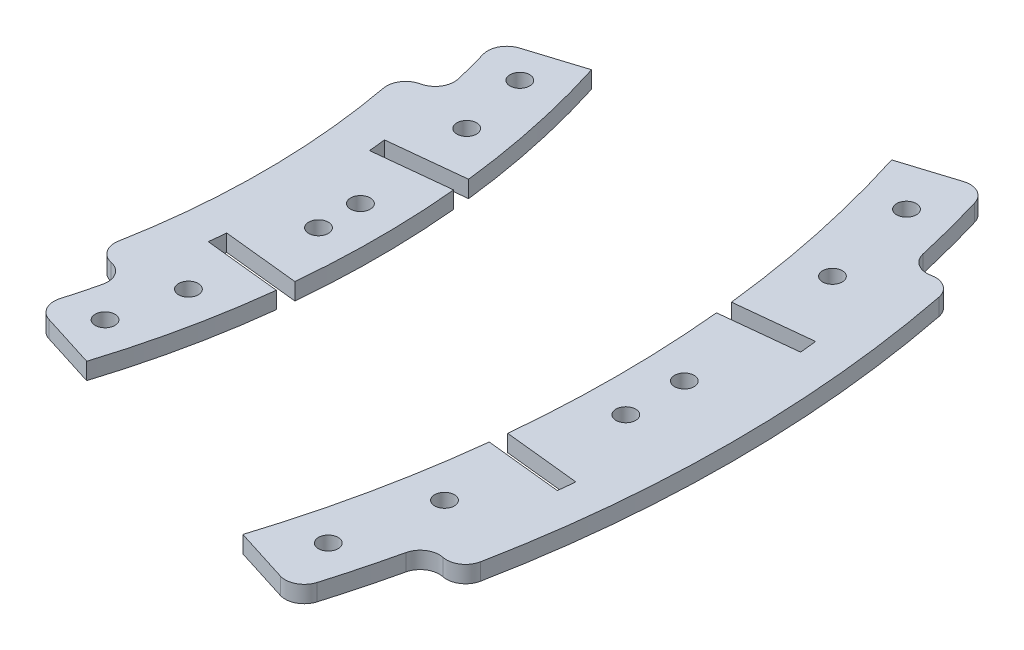
from build123d import *

# Parameters (mm, degrees)
BOSS_EXTRUDE1_DEPTH = 5.588
SKETCH9_R           = 3.2639
CUT_EXTRUDE4_DEPTH  = 5.588
CUT_EXTRUDE3_DEPTH  = 401.395458897
BOSS_EXTRUDE2_DEPTH = 5.588
FILLET1_R           = 6.35
SKETCH12_R          = 357.997386184
SKETCH12_R_2        = 278.622386184
CUT_EXTRUDE8_DEPTH  = 413.11957813
MIRROR1_OUTLINE_R   = 3.2639
MIRROR1_DEPTH       = 5.588


# Read off the part's stored shape, not the designer's step: Mirror1
with BuildPart() as part:
    # Sketch2 → Boss-Extrude1 (new body)
    with BuildSketch(Plane(origin=(0, 0, 0), x_dir=(1, 0, 0), z_dir=(0, 1, 0))):
        with BuildLine():
            Line((365.652586076, 115.28981754), (241.502482012, 76.14544009))
            ThreePointArc((241.502482012, 76.14544009), (250.275260093, 38.521046845), (253.222386184, 0))
            Line((253.222386184, 0), (383.397386184, 0))
            ThreePointArc((383.397386184, 0), (378.935219718, 58.323708643), (365.652586076, 115.28981754))
        make_face()
    extrude(amount=BOSS_EXTRUDE1_DEPTH)

    # Sketch9 → Cut-Extrude4 (cut)
    with BuildSketch(Plane(origin=(0, 0, 0), x_dir=(1, 0, 0), z_dir=(0, 1, 0))):
        with Locations(Location((256.861300603, 68.825778063, 0), (0, 0, 270))):
            Circle(SKETCH9_R)
        with Locations(Location((261.882427613, 46.176937762, 0), (0, 0, 270))):
            Circle(SKETCH9_R)
        with Locations(Location((265.831261224, 6.961036557, 0), (0, 0, 270))):
            Circle(SKETCH9_R)
        with Locations(Location((365.065659935, 64.370925577, 0), (0, 0, 270))):
            Circle(SKETCH9_R)
        with Locations(Location((358.066179053, 95.943543514, 0), (0, 0, 270))):
            Circle(SKETCH9_R)
        with Locations(Location((370.570357448, 9.703726316, 0), (0, 0, 270))):
            Circle(SKETCH9_R)
    extrude(amount=CUT_EXTRUDE4_DEPTH, mode=Mode.SUBTRACT)

    # Sketch8 → Cut-Extrude3 (cut, through all)
    with BuildSketch(Plane(origin=(0, 0, 0), x_dir=(1, 0, 0), z_dir=(0, 1, 0))):
        Polygon((251.928355604, 23.669347024), (283.504425782, 26.988125733), (282.92032073, 32.545514085), (251.344250552, 29.226735376), align=None)
        Polygon((350.211981914, 33.999372407), (381.788052092, 37.318151116), (381.203947039, 42.875539467), (349.627876862, 39.556760758), align=None)
    extrude(amount=CUT_EXTRUDE3_DEPTH, mode=Mode.SUBTRACT)

    # Sketch11 → Boss-Extrude2 (add)
    with BuildSketch(Plane(origin=(0, 0, 0), x_dir=(1, 0, 0), z_dir=(0, 1, 0))):
        with BuildLine():
            Line((247.688869498, 52.647894464), (235.266394968, 50.007415991))
            ThreePointArc((235.266394968, 50.007415991), (239.204779386, 25.141435409), (240.522386184, 0))
            Line((240.522386184, 0), (253.222386184, 0))
            ThreePointArc((253.222386184, 0), (251.835207457, 26.468946893), (247.688869498, 52.647894464))
        make_face()
        with BuildLine():
            Line((387.441707953, 82.35327729), (375.019233423, 79.712798817))
            ThreePointArc((375.019233423, 79.712798817), (381.297095187, 40.075939599), (383.397386184, 0))
            Line((383.397386184, 0), (396.097386184, 0))
            ThreePointArc((396.097386184, 0), (393.927523258, 41.403451082), (387.441707953, 82.35327729))
        make_face()
    extrude(amount=BOSS_EXTRUDE2_DEPTH)

    # Fillet1
    fillet1_edges = [part.edges().sort_by_distance(p)[0] for p in [
        (235.266394968, 2.794, -50.007415991),
        (387.441707953, 2.794, -82.35327729),
        (375.019233423, 2.794, -79.712798817),
        (247.688869498, 2.794, -52.647894464),
        (365.652586076, 2.794, -115.28981754),
        (241.502482012, 2.794, -76.14544009),
    ]]
    fillet(fillet1_edges, radius=FILLET1_R - 0.0001)  # a hair under: the kernel refuses the full size

    # Sketch12 → Cut-Extrude8 (cut, through all)
    with BuildSketch(Plane(origin=(0, 0, 0), x_dir=(1, 0, 0), z_dir=(0, 1, 0))):
        Circle(SKETCH12_R)
        Circle(SKETCH12_R_2, mode=Mode.SUBTRACT)
    extrude(amount=CUT_EXTRUDE8_DEPTH, mode=Mode.SUBTRACT)


with BuildPart() as cut_extrude8_piece_1:
    # of the separate pieces the step leaves, piece 1, a body of its own (cut_extrude8_pieces)
    add(part.part.solids().sort_by_distance((359.545580237, 0, -113.364285996))[0])



with BuildPart() as cut_extrude8_piece_2:
    # of the separate pieces the step leaves, piece 2, a body of its own (cut_extrude8_pieces)
    add(part.part.solids().sort_by_distance((265.726892561, 0, -83.783367397))[0])


with BuildPart() as cut_extrude8_piece_1_1:
    add(cut_extrude8_piece_1.part)

    add(cut_extrude8_piece_2.part)  # Mirror1 merges Cut-Extrude8 piece 2
    # Mirror1 outline → Mirror1 (add)
    # profile 1 of 2: a face of its own
    with BuildSketch(Plane(origin=(0, 0, 0), x_dir=(1, 0, 0), z_dir=(0, 1, 0))):
        with BuildLine():
            ThreePointArc((367.542367114, -109.115370636), (370.789659245, -97.511970185), (373.670726786, -85.812258307))
            ThreePointArc((373.670726786, -85.812258307), (376.444671415, -81.879963574), (381.179868714, -81.022282272))
            ThreePointArc((381.179868714, -81.022282272), (386.001836103, -80.108251813), (388.732030913, -76.029911772))
            ThreePointArc((388.732030913, -76.029911772), (394.251747436, -38.192918003), (396.097386184, 0))
            Line((396.097386184, 0), (357.997386184, 0))
            ThreePointArc((357.997386184, 0), (357.577155049, -17.3408968), (356.31744821, -34.641082773))
            Line((356.31744821, -34.641082773), (381.579022742, -37.296181246))
            ThreePointArc((381.579022742, -37.296181246), (381.297095187, -40.075939599), (380.99491769, -42.853569597))
            Line((380.99491769, -42.853569597), (355.733343157, -40.198471124))
            ThreePointArc((355.733343157, -40.198471124), (350.208561747, -74.270396482), (341.428175527, -107.651890233))
            Line((341.428175527, -107.651890233), (359.545483246, -113.364255414))
            ThreePointArc((359.545483246, -113.364255414), (364.434396192, -112.915780636), (367.542367114, -109.115370636))
        make_face()
        with Locations((358.066179053, -95.943543514)):
            Circle(MIRROR1_OUTLINE_R, mode=Mode.SUBTRACT)
        with Locations((365.065659935, -64.370925577)):
            Circle(MIRROR1_OUTLINE_R, mode=Mode.SUBTRACT)
        with Locations((370.570357448, -9.703726316)):
            Circle(MIRROR1_OUTLINE_R, mode=Mode.SUBTRACT)
    # profile 2 of 2: a face of its own
    with BuildSketch(Plane(origin=(0, 0, 0), x_dir=(1, 0, 0), z_dir=(0, 1, 0))):
        with BuildLine():
            Line((247.484497403, -78.031562297), (265.726892561, -83.783367397))
            ThreePointArc((265.726892561, -83.783367397), (272.496065657, -58.106181121), (276.790078476, -31.90119966))
            Line((276.790078476, -31.90119966), (251.527824715, -29.246029798))
            ThreePointArc((251.527824715, -29.246029798), (251.835207457, -26.468946893), (252.111929767, -23.688641446))
            Line((252.111929767, -23.688641446), (277.374183529, -26.343811309))
            ThreePointArc((277.374183529, -26.343811309), (278.310160579, -13.186682715), (278.622386184, 0))
            Line((278.622386184, 0), (240.522386184, 0))
            ThreePointArc((240.522386184, 0), (239.50836087, -22.062713545), (236.474835046, -43.939397421))
            ThreePointArc((236.474835046, -43.939397421), (237.437341139, -48.626104602), (241.397736942, -51.310672959))
            ThreePointArc((241.397736942, -51.310672959), (245.447097835, -54.132235543), (246.252721001, -59.001476795))
            ThreePointArc((246.252721001, -59.001476795), (244.837051226, -64.625035488), (243.292976764, -70.214701609))
            ThreePointArc((243.292976764, -70.214701609), (243.797749033, -74.976244157), (247.484497403, -78.031562297))
        make_face()
        with Locations((256.861300603, -68.825778063)):
            Circle(MIRROR1_OUTLINE_R, mode=Mode.SUBTRACT)
        with Locations((261.882427613, -46.176937762)):
            Circle(MIRROR1_OUTLINE_R, mode=Mode.SUBTRACT)
        with Locations((265.831261224, -6.961036557)):
            Circle(MIRROR1_OUTLINE_R, mode=Mode.SUBTRACT)
    extrude(amount=MIRROR1_DEPTH)


solid = cut_extrude8_piece_1_1.part
